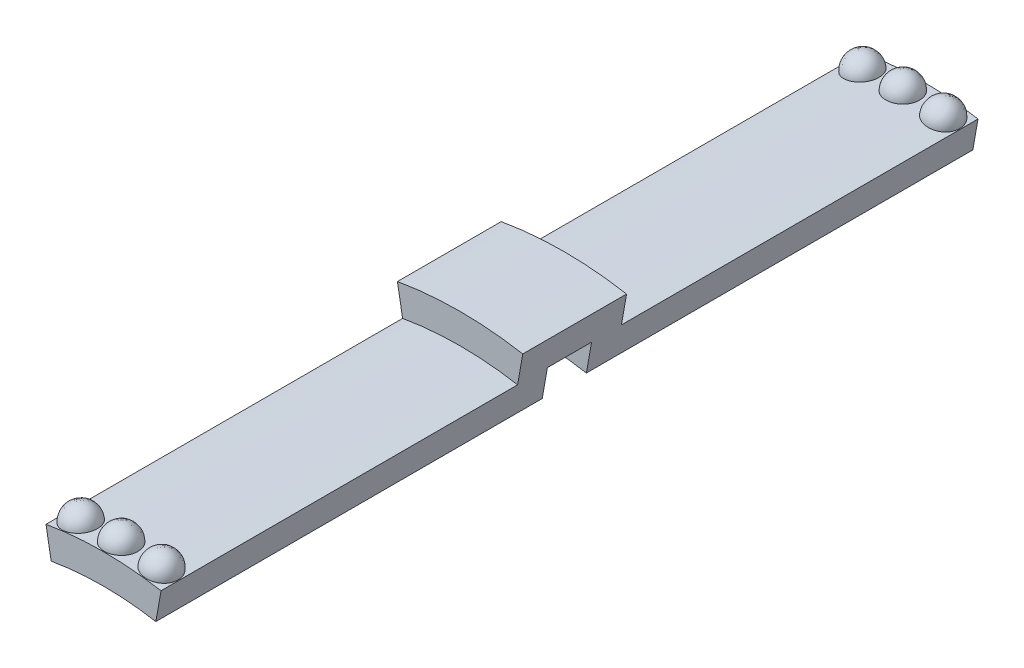
from build123d import *
from build123d.topology import SkipClean

# Parameters (mm, degrees)
REVOLVE1_ANGLE                  = 20
CIRPATTERN1_COUNT               = 2
CIRPATTERN1_ANGLE               = 7
CIRPATTERN1_THE_OTHER_WAY_COUNT = 2
CIRPATTERN1_THE_OTHER_WAY_ANGLE = 7


with BuildPart() as part:
    # Sketch2 → Revolve1 (revolve, symmetric)
    with BuildSketch(Plane(origin=(0, 0, 0), x_dir=(0, 0, -1), z_dir=(1, 0, 0))) as revolve1_sk:
        Polygon((0, 30), (2, 30), (2, 27.3), (37, 27.3), (37, 30), (4.7, 30), (4.7, 32.7), (0, 32.7), align=None)
    revolve(axis=Axis((0, 0, 0), (0, 0, -1)), revolution_arc=REVOLVE1_ANGLE / 2)
    revolve(revolve1_sk.sketch, axis=Axis((0, 0, 0), (0, 0, 1)), revolution_arc=REVOLVE1_ANGLE / 2)

    # Sketch3 → Revolve2 (revolve)
    with SkipClean():  # the faces are left unmerged after this step: merging them gives an invalid solid
        with BuildSketch(Plane(origin=(0, 0, -35.4), x_dir=(-1, 0, 0), z_dir=(0, 0, -1))):
            with BuildLine():
                Line((-1.499531177, 29.9625), (1.499531177, 29.9625))
                ThreePointArc((1.499531177, 29.9625), (0, 31.5), (-1.499531177, 29.9625))
            make_face()
        revolve2 = revolve(axis=Axis((1.499531177, 29.9625, -35.4), (-1, 0, 0)))
    add(part.part.scale(1), mode=Mode.REPLACE)  # the faces are merged on a copy

    # CirPattern1: Revolve2 ×2 about axis
    with SkipClean():  # the faces are left unmerged after this step: merging them gives an invalid solid
        cirpattern1_axis = Axis((0, 0, 0), (0, 0, -1))
        for i in range(1, CIRPATTERN1_COUNT):
            add(revolve2.rotate(cirpattern1_axis, i * CIRPATTERN1_ANGLE / (CIRPATTERN1_COUNT - 1)))
    add(part.part.scale(1), mode=Mode.REPLACE)  # the faces are merged on a copy

    # CirPattern1 the other way: Revolve2 ×2 about axis
    with SkipClean():  # the faces are left unmerged after this step: merging them gives an invalid solid
        cirpattern1_the_other_way_axis = Axis((0, 0, 0), (0, 0, 1))
        for i in range(1, CIRPATTERN1_THE_OTHER_WAY_COUNT):
            add(revolve2.rotate(cirpattern1_the_other_way_axis, i * CIRPATTERN1_THE_OTHER_WAY_ANGLE / (CIRPATTERN1_THE_OTHER_WAY_COUNT - 1)))
    add(part.part.scale(1), mode=Mode.REPLACE)  # the faces are merged on a copy

    # Mirror2: part across plane


with BuildPart() as part_1:
    add(part.part)
    add(part.part.mirror(Plane.XY))


solid = part_1.part
